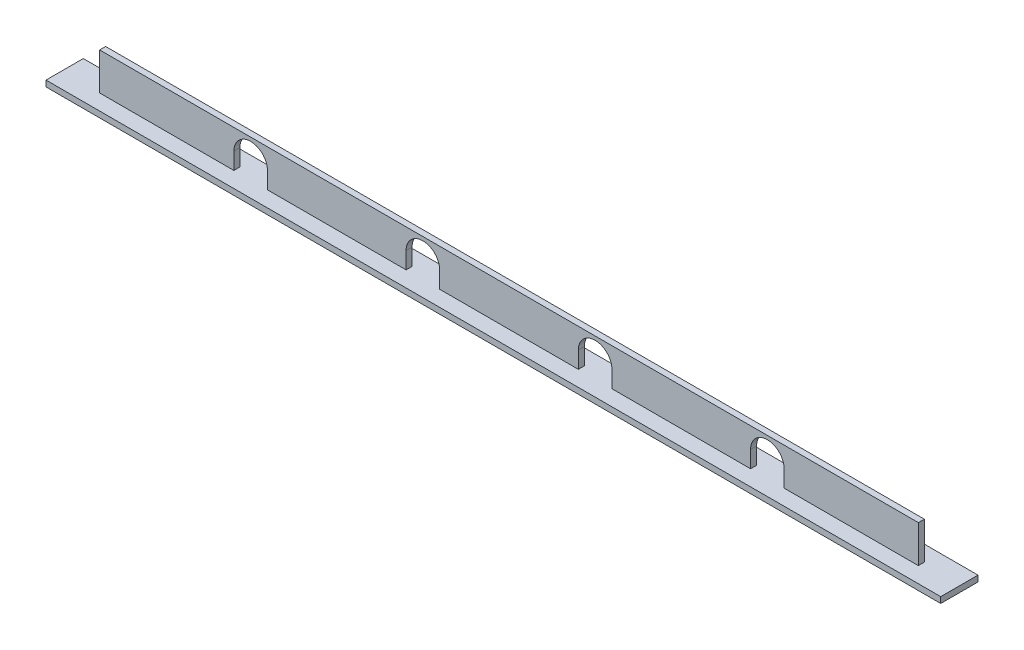
from build123d import *

# Parameters (mm, degrees)
EXTRUDE_1_DEPTH      = 4
SKETCH_3_OUTSIDE_W   = 1454.212
SKETCH_3_OUTSIDE_H   = 252.212
SKETCH_3_OUTSIDE_W_2 = 1098
SKETCH_3_OUTSIDE_H_2 = 8
CUT_EXTRUDE_1_DEPTH  = 608.075777807
SKETCH_2_W           = 1200
SKETCH_2_H           = 50
EXTRUDE_2_DEPTH      = 8


with BuildPart() as part:
    # Эскиз1 → Бобышка-Вытянуть1 (new, symmetric)
    with BuildSketch(Plane.XY):
        with BuildLine():
            Line((-600, -2.5), (-600, -25))
            Line((-600, -25), (-605, -25))
            Line((-605, -25), (-605, 25))
            Line((-605, 25), (605, 25))
            Line((605, 25), (605, -25))
            Line((605, -25), (600, -25))
            Line((600, -25), (600, -2.5))
            ThreePointArc((600, -2.5), (577.5, 20), (555, -2.5))
            Line((555, -2.5), (555, -25))
            Line((555, -25), (369, -25))
            Line((369, -25), (369, -2.5))
            ThreePointArc((369, -2.5), (346.5, 20), (324, -2.5))
            Line((324, -2.5), (324, -25))
            Line((324, -25), (138, -25))
            Line((138, -25), (138, -2.5))
            ThreePointArc((138, -2.5), (115.5, 20), (93, -2.5))
            Line((93, -2.5), (93, -25))
            Line((93, -25), (-93, -25))
            Line((-93, -25), (-93, -2.5))
            ThreePointArc((-93, -2.5), (-115.5, 20), (-138, -2.5))
            Line((-138, -2.5), (-138, -25))
            Line((-138, -25), (-324, -25))
            Line((-324, -25), (-324, -2.5))
            ThreePointArc((-324, -2.5), (-346.5, 20), (-369, -2.5))
            Line((-369, -2.5), (-369, -25))
            Line((-369, -25), (-555, -25))
            Line((-555, -25), (-555, -2.5))
            ThreePointArc((-555, -2.5), (-577.5, 20), (-600, -2.5))
        make_face()
    extrude(amount=EXTRUDE_1_DEPTH, both=True)

    # Эскиз3 outside → Вырез-Вытянуть1 (cut, through all)
    with BuildSketch(Plane(origin=(0, 25, 0), x_dir=(1, 0, 0), z_dir=(0, 1, 0))):
        Rectangle(SKETCH_3_OUTSIDE_W, SKETCH_3_OUTSIDE_H)
        Rectangle(SKETCH_3_OUTSIDE_W_2, SKETCH_3_OUTSIDE_H_2, mode=Mode.SUBTRACT)
    extrude(amount=-CUT_EXTRUDE_1_DEPTH, mode=Mode.SUBTRACT)


with BuildPart() as body_2:
    # Эскиз2 → Бобышка-Вытянуть2 (new body)
    with BuildSketch(Plane.XZ.offset(25)):
        Rectangle(SKETCH_2_W, SKETCH_2_H)
    extrude(amount=EXTRUDE_2_DEPTH)


solid = Compound([part.part, body_2.part])
